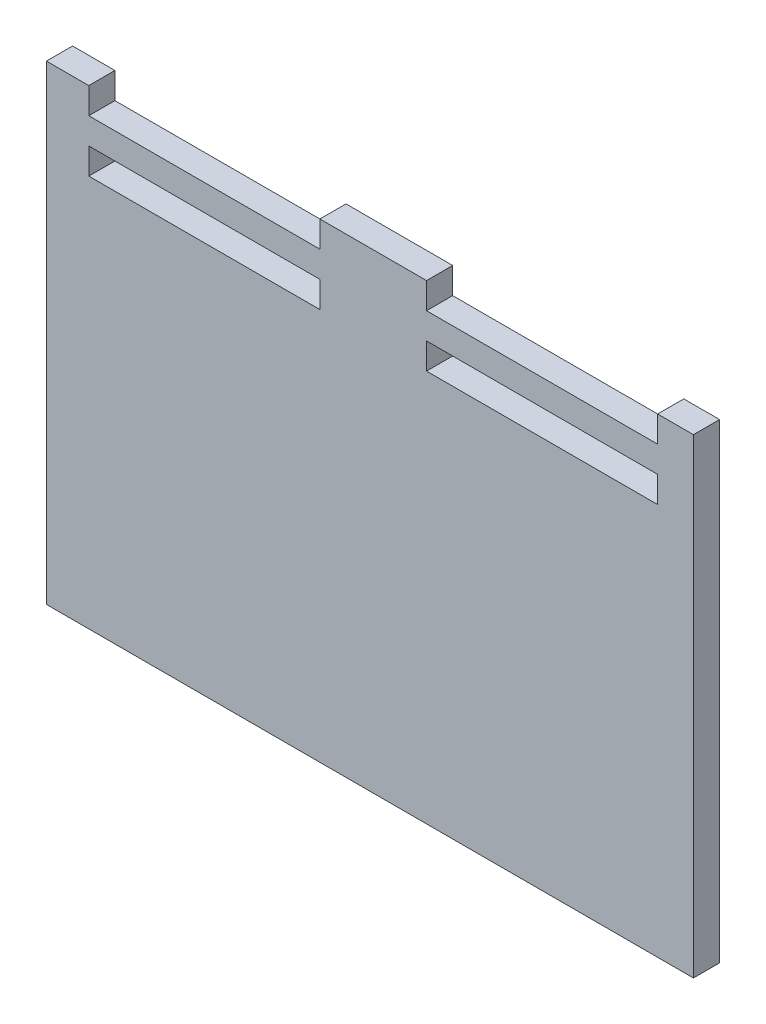
from build123d import *

# Parameters (mm, degrees)
SKETCH1_W           = 304.8
SKETCH1_H           = 228.6
BOSS_EXTRUDE1_DEPTH = 12.7
SKETCH7_W           = 112.268
SKETCH7_H           = 12.7
CUT_EXTRUDE2_DEPTH  = 12.7
SKETCH8_W           = 3.175
SKETCH8_H           = 228.6
SKETCH8_W_2         = 6.35
BOSS_EXTRUDE2_DEPTH = 12.7


with BuildPart() as part:
    # Sketch1 → Boss-Extrude1 (new body)
    with BuildSketch(Plane.XY):
        with Locations((152.4, 114.3)):
            Rectangle(SKETCH1_W, SKETCH1_H)
    extrude(amount=BOSS_EXTRUDE1_DEPTH)

    # Sketch7 → Cut-Extrude2 (cut)
    with BuildSketch(Plane.XY.offset(12.7)):
        with Locations((70.358, 222.25)):
            Rectangle(SKETCH7_W, SKETCH7_H)
        with Locations((234.442, 222.25)):
            Rectangle(SKETCH7_W, SKETCH7_H)
        with Locations((70.358, 196.85)):
            Rectangle(SKETCH7_W, SKETCH7_H)
        with Locations((234.442, 196.85)):
            Rectangle(SKETCH7_W, SKETCH7_H)
    extrude(amount=-CUT_EXTRUDE2_DEPTH, mode=Mode.SUBTRACT)

    # Sketch8 → Boss-Extrude2 (add)
    with BuildSketch(Plane.XY.offset(12.7)):
        with Locations((306.3875, 114.3)):
            Rectangle(SKETCH8_W, SKETCH8_H)
        with Locations((-3.175, 114.3)):
            Rectangle(SKETCH8_W_2, SKETCH8_H)
    extrude(amount=-BOSS_EXTRUDE2_DEPTH)


solid = part.part
